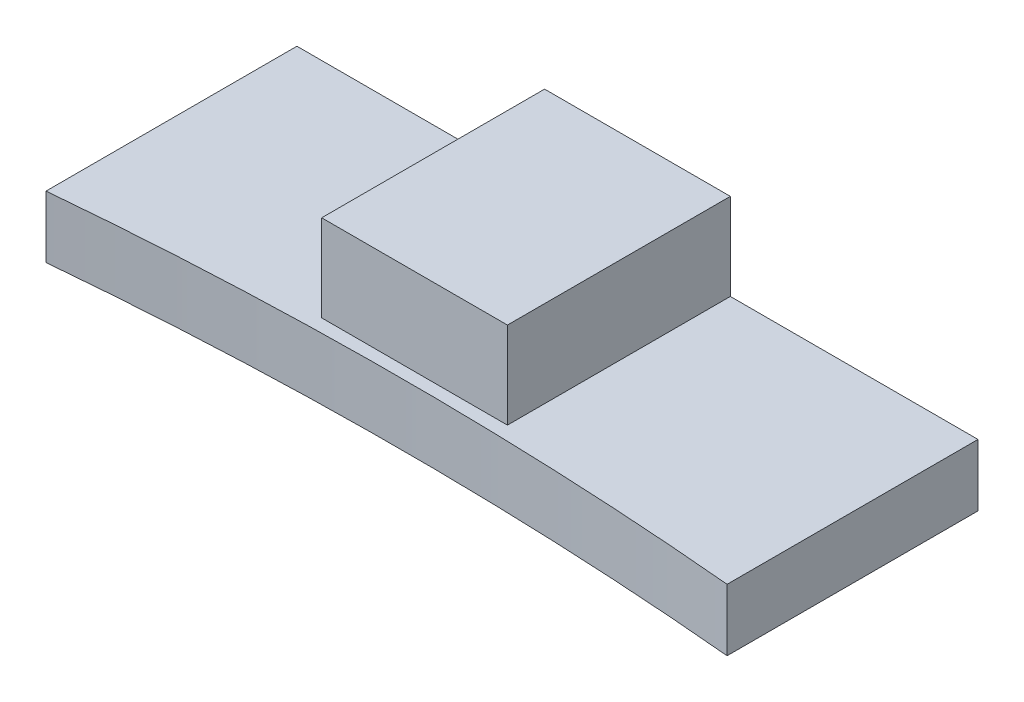
from build123d import *

# Parameters (mm, degrees)
BOSS_EXTRUDE1_DEPTH              = 5
SKETCH2_W                        = 15
SKETCH2_H                        = 18
BOSS_EXTRUDE2_DEPTH              = 7
SKETCH3_R                        = 4.5
CUT_EXTRUDE2_DEPTH               = 4
TAP_DRILL_FOR_M8X1_25_TAP1_D     = 6.8
TAP_DRILL_FOR_M8X1_25_TAP1_DEPTH = 8


with BuildPart() as part:
    # Sketch1 → Boss-Extrude1 (new body)
    with BuildSketch(Plane(origin=(0, 0, 0), x_dir=(1, 0, 0), z_dir=(0, 1, 0))):
        with BuildLine():
            Line((0, 0), (0, 20.2630756))
            Line((0, 20.2630756), (55, 20.2630756))
            Line((55, 20.2630756), (55, 0))
            ThreePointArc((55, 0), (27.5, 1.2630756), (0, 0))
        make_face()
    extrude(amount=BOSS_EXTRUDE1_DEPTH)

    # Sketch2 → Boss-Extrude2 (add)
    with BuildSketch(Plane(origin=(0, 5, 0), x_dir=(1, 0, 0), z_dir=(0, 1, 0))):
        with Locations((27.5, 11.2630756)):
            Rectangle(SKETCH2_W, SKETCH2_H)
    extrude(amount=BOSS_EXTRUDE2_DEPTH)

    # Sketch3 → Cut-Extrude2 (cut)
    with BuildSketch(Plane(origin=(0, 0, -20.2630756), x_dir=(-1, 0, 0), z_dir=(0, 0, -1))):
        with Locations((-27.5, 6.5)):
            Circle(SKETCH3_R)
    extrude(amount=-CUT_EXTRUDE2_DEPTH, mode=Mode.SUBTRACT)

    # Tap Drill for M8x1.25 Tap1
    with Locations(Plane(origin=(0, 0, -16.2630756), x_dir=(-1, 0, 0), z_dir=(0, 0, -1))):
        with Locations((-27.5, 6.5)):
            Hole(TAP_DRILL_FOR_M8X1_25_TAP1_D / 2, depth=TAP_DRILL_FOR_M8X1_25_TAP1_DEPTH)


solid = part.part
